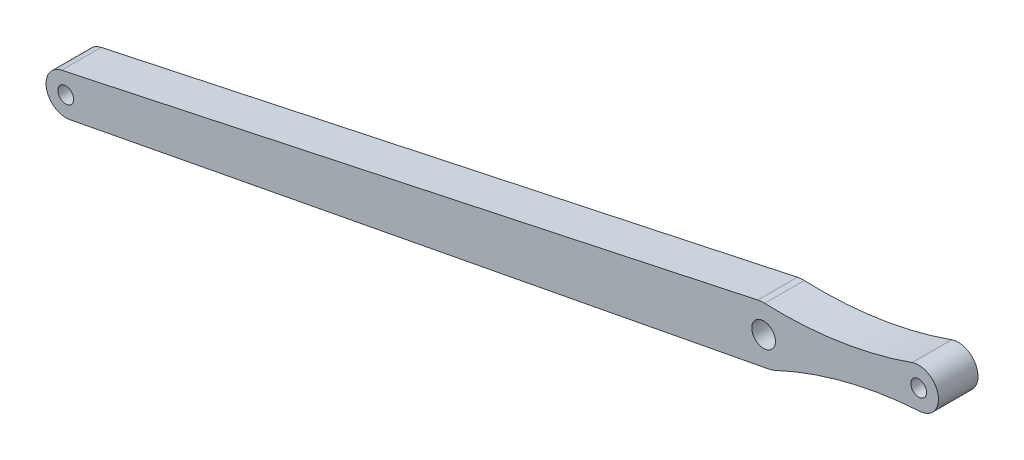
from build123d import *

# Parameters (mm, degrees)
BOSS_EXTRUDE1_DEPTH      = 5
BOSS_EXTRUDE1_DEPTH_BACK = 5
SKETCH1_R                = 3
SKETCH1_R_2              = 2


with BuildPart() as part:
    # Sketch1 → Boss-Extrude1 (new, two sides: drawn at the far end of the back side and taken through both)
    with BuildSketch(Plane.XY.offset(-BOSS_EXTRUDE1_DEPTH_BACK)):
        with BuildLine():
            Line((-225.869096848, 107.363231548), (-49.074771971, 141.123662404))
            ThreePointArc((-49.074771971, 141.123662404), (-48.228380437, 141.340811814), (-47.415636973, 141.661717653))
            ThreePointArc((-47.415636973, 141.661717653), (-29.592726055, 148.04093481), (-10.886983745, 150.947095462))
            ThreePointArc((-10.886983745, 150.947095462), (-6.282962212, 156.930655082), (-12.85215578, 160.651635579))
            ThreePointArc((-12.85215578, 160.651635579), (-31.214852935, 156.051427073), (-50.115452759, 154.994123233))
            ThreePointArc((-50.115452759, 154.994123233), (-50.989014043, 154.973551898), (-51.853206387, 154.844307603))
            Line((-51.853206387, 154.844307603), (-227.853692859, 117.163692404))
            ThreePointArc((-227.853692859, 117.163692404), (-231.707477427, 111.282128926), (-225.869096848, 107.363231548))
        make_face()
        with Locations((-50.387758667, 147.999421703)):
            Circle(SKETCH1_R, mode=Mode.SUBTRACT)
        with Locations((-226.806944487, 112.27448819)):
            Circle(SKETCH1_R_2, mode=Mode.SUBTRACT)
        with Locations((-11.183495151, 155.938295817)):
            Circle(SKETCH1_R_2, mode=Mode.SUBTRACT)
    extrude(amount=BOSS_EXTRUDE1_DEPTH + BOSS_EXTRUDE1_DEPTH_BACK)


solid = part.part
